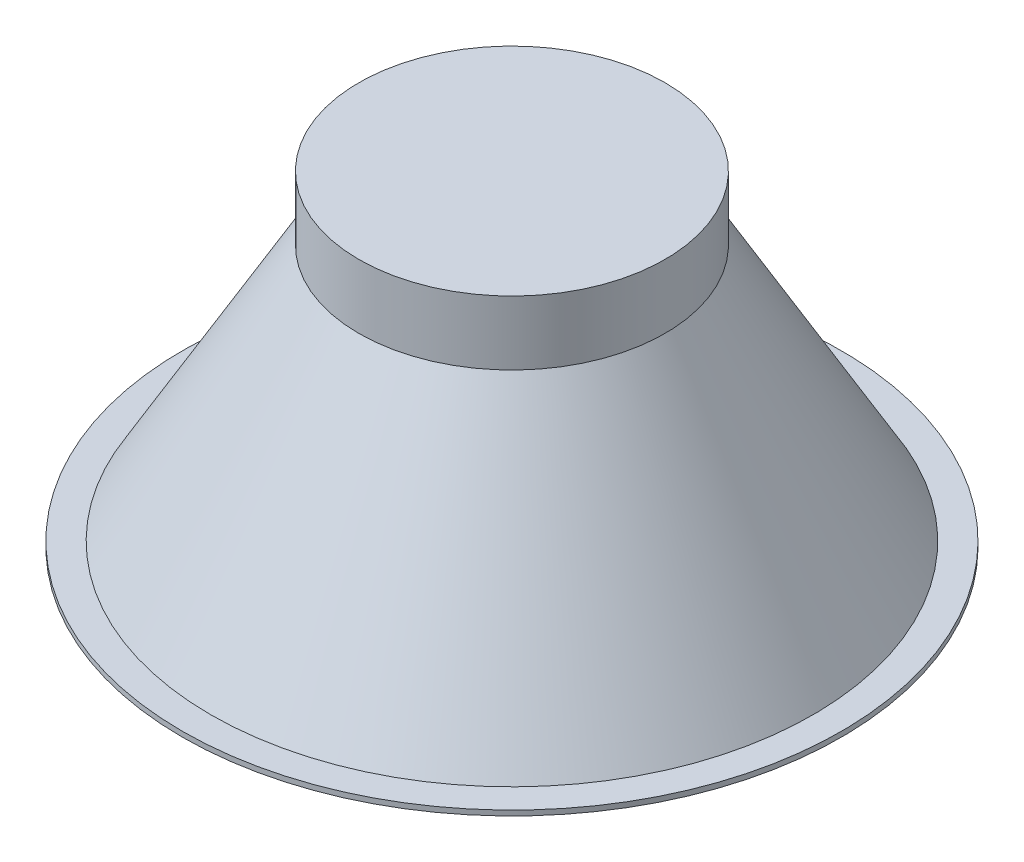
from build123d import *

# Parameters (mm, degrees)
SKETCH1_R           = 128.5875
BOSS_EXTRUDE1_DEPTH = 2
SKETCH2_R           = 117.475
BOSS_EXTRUDE2_DEPTH = 100
BOSS_EXTRUDE2_TAPER = 30
SKETCH6_R           = 59.739973081
BOSS_EXTRUDE3_DEPTH = 25


with BuildPart() as part:
    # Sketch1 → Boss-Extrude1 (new body)
    with BuildSketch(Plane(origin=(0, 0, 0), x_dir=(1, 0, 0), z_dir=(0, 1, 0))):
        Circle(SKETCH1_R)
    extrude(amount=BOSS_EXTRUDE1_DEPTH)

    # Sketch2 → Boss-Extrude2 (add)
    with BuildSketch(Plane(origin=(0, 2, 0), x_dir=(1, 0, 0), z_dir=(0, 1, 0))):
        Circle(SKETCH2_R)
    extrude(amount=BOSS_EXTRUDE2_DEPTH, taper=BOSS_EXTRUDE2_TAPER)

    # Sketch6 → Boss-Extrude3 (add)
    with BuildSketch(Plane(origin=(0, 102, 0), x_dir=(1, 0, 0), z_dir=(0, 1, 0))):
        Circle(SKETCH6_R)
    extrude(amount=BOSS_EXTRUDE3_DEPTH)


solid = part.part
